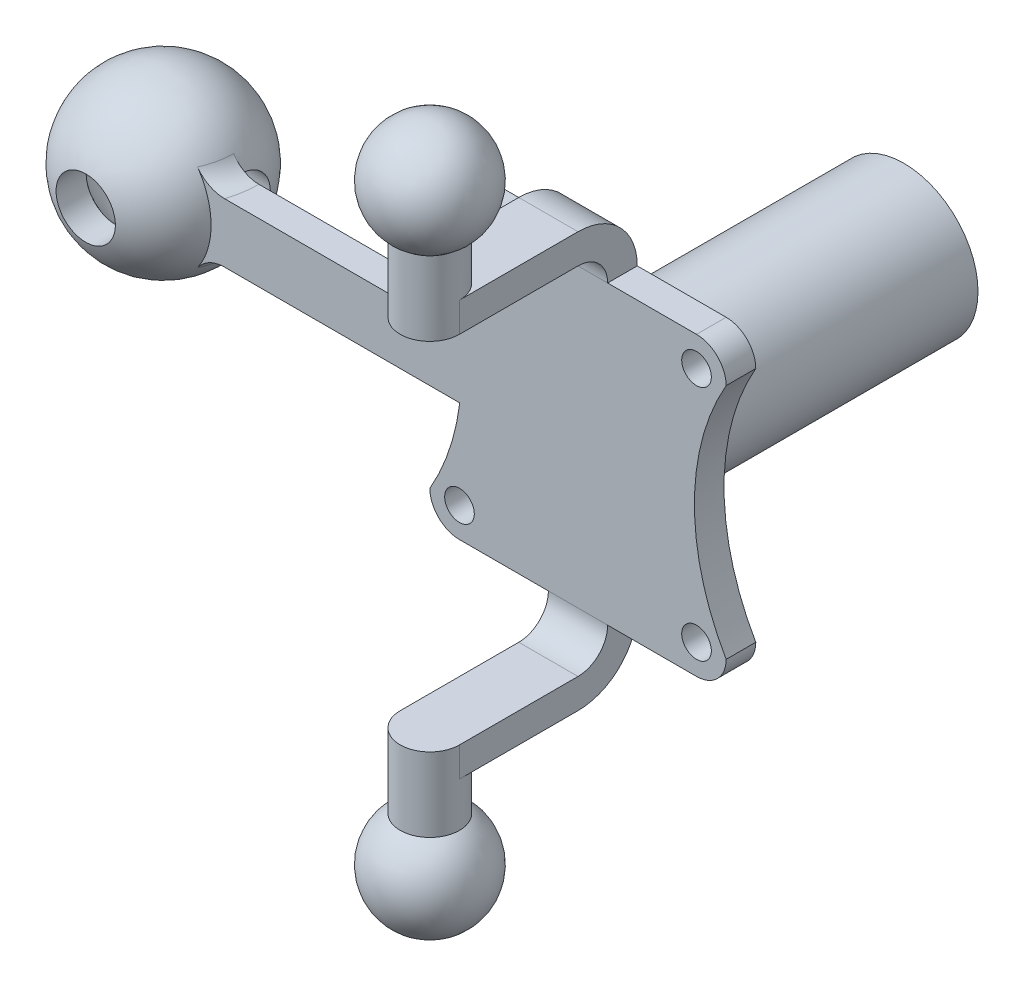
from build123d import *

# Parameters (mm, degrees)
BOSS_EXTRUDE1_DEPTH  = 10
CUT_EXTRUDE1_DEPTH   = 10
SKETCH6_W            = 20
SKETCH6_H            = 10
BOSS_EXTRUDE5_DEPTH  = 10
SKETCH7_W            = 20
SKETCH7_H            = 10
BOSS_EXTRUDE6_DEPTH  = 60
FILLET7_R            = 20
FILLET8_R            = 10
BOSS_EXTRUDE7_DEPTH  = 10
CUT_EXTRUDE7_DEPTH   = 18
FILLET7_OF_MIRROR2_R = 20
FILLET8_OF_MIRROR2_R = 10
SKETCH19_R           = 5
CUT_EXTRUDE9_DEPTH   = 30
SKETCH29_R           = 10
BOSS_EXTRUDE16_DEPTH = 15
SKETCH31_R           = 10
BOSS_EXTRUDE17_DEPTH = 15
BOSS_EXTRUDE21_DEPTH = 10
FILLET9_R            = 10
FILLET10_R           = 10
SKETCH35_R           = 10
CUT_EXTRUDE11_DEPTH  = 30
SKETCH16_R           = 25
BOSS_EXTRUDE22_DEPTH = 100


with BuildPart() as part:
    # Sketch2 → Boss-Extrude1 (new body)
    with BuildSketch(Plane.XY):
        with BuildLine():
            Line((-40, 50), (40, 50))
            ThreePointArc((40, 50), (47.071067812, 47.071067812), (50, 40))
            Line((50, 40), (50, -40))
            ThreePointArc((50, -40), (47.071067812, -47.071067812), (40, -50))
            Line((40, -50), (-40, -50))
            ThreePointArc((-40, -50), (-47.071067812, -47.071067812), (-50, -40))
            Line((-50, -40), (-50, 40))
            ThreePointArc((-50, 40), (-47.071067812, 47.071067812), (-40, 50))
        make_face()
    boss_extrude1 = extrude(amount=BOSS_EXTRUDE1_DEPTH)

    # Sketch3 → Cut-Extrude1 (cut)
    with BuildSketch(Plane.XY.offset(10)):
        with BuildLine():
            Line((-50, 40), (-50, -40))
            ThreePointArc((-50, -40), (-39.282032303, 0), (-50, 40))
        make_face()
        with BuildLine():
            Line((50, 40), (50, -40))
            ThreePointArc((50, -40), (39.282032303, 0), (50, 40))
        make_face()
    cut_extrude1 = extrude(amount=-CUT_EXTRUDE1_DEPTH, mode=Mode.SUBTRACT)

    # Sketch6 → Boss-Extrude5 (add)
    with BuildSketch(Plane.XZ.offset(50)):
        with Locations((0, 5)):
            Rectangle(SKETCH6_W, SKETCH6_H)
    boss_extrude5 = extrude(amount=BOSS_EXTRUDE5_DEPTH)

    # Sketch7 → Boss-Extrude6 (add)
    with BuildSketch(Plane.XY):
        with Locations((0, -65)):
            Rectangle(SKETCH7_W, SKETCH7_H)
    boss_extrude6 = extrude(amount=BOSS_EXTRUDE6_DEPTH)

    # Fillet7
    fillet7_edges = [part.edges().sort_by_distance(p)[0] for p in [
        (0, -70, 0),
    ]]
    fillet(fillet7_edges, radius=FILLET7_R)

    # Fillet8
    fillet8_edges = [part.edges().sort_by_distance(p)[0] for p in [
        (0, -60, 10),
    ]]
    fillet(fillet8_edges, radius=FILLET8_R)

    # Sketch8 → Boss-Extrude7 (add)
    with BuildSketch(Plane(origin=(0, -60, 0), x_dir=(1, 0, 0), z_dir=(0, 1, 0))):
        with BuildLine():
            Line((10, -60), (-10, -60))
            ThreePointArc((-10, -60), (0, -70), (10, -60))
        make_face()
    boss_extrude7 = extrude(amount=-BOSS_EXTRUDE7_DEPTH)

    # Sketch14 → Cut-Extrude7 (cut)
    with BuildSketch(Plane.XY.offset(10)):
        with BuildLine():
            Line((-39.282032303, 0), (39.282032303, 0))
            add(Edge.make_bspline(
                [(50, 40), (39.359472874, 21.350658255), (39.282032303, 0)],
                knots=[0, 0, 0, 1, 1, 1], degree=2))
            add(Edge.make_bspline(
                [(40, 50), (49.142135624, 49.142135624), (50, 40)],
                knots=[0, 0, 0, 1, 1, 1], degree=2))
            Line((40, 50), (-40, 50))
            add(Edge.make_bspline(
                [(-50, 40), (-49.142135624, 49.142135624), (-40, 50)],
                knots=[0, 0, 0, 1, 1, 1], degree=2))
            add(Edge.make_bspline(
                [(-39.282032303, 0), (-39.359472874, 21.350658255), (-50, 40)],
                knots=[0, 0, 0, 1, 1, 1], degree=2))
        make_face()
    extrude(amount=-CUT_EXTRUDE7_DEPTH, mode=Mode.SUBTRACT)


with BuildPart() as cut_extrude7_kept_piece:
    # of the separate pieces the step leaves, the one the design keeps (cut_extrude7_pieces_kept)
    add(part.part.solids().sort_by_distance((-10, -60, 20))[0])

    # Mirror2: Boss-Extrude1, Cut-Extrude1, Boss-Extrude5, Boss-Extrude6, Boss-Extrude7 across plane
    add(boss_extrude1.mirror(Plane(origin=(-39.282032303, 0, -8), x_dir=(0, 0, 1), z_dir=(0, -1, 0))))
    add(cut_extrude1.mirror(Plane(origin=(-39.282032303, 0, -8), x_dir=(0, 0, 1), z_dir=(0, -1, 0))), mode=Mode.SUBTRACT)
    add(boss_extrude5.mirror(Plane(origin=(-39.282032303, 0, -8), x_dir=(0, 0, 1), z_dir=(0, -1, 0))))
    add(boss_extrude6.mirror(Plane(origin=(-39.282032303, 0, -8), x_dir=(0, 0, 1), z_dir=(0, -1, 0))))
    add(boss_extrude7.mirror(Plane(origin=(-39.282032303, 0, -8), x_dir=(0, 0, 1), z_dir=(0, -1, 0))))

    # Fillet7 of Mirror2
    fillet7_of_mirror2_edges = [cut_extrude7_kept_piece.edges().sort_by_distance(p)[0] for p in [
        (0, 70, 0),
    ]]
    fillet(fillet7_of_mirror2_edges, radius=FILLET7_OF_MIRROR2_R)

    # Fillet8 of Mirror2
    fillet8_of_mirror2_edges = [cut_extrude7_kept_piece.edges().sort_by_distance(p)[0] for p in [
        (0, 60, 10),
    ]]
    fillet(fillet8_of_mirror2_edges, radius=FILLET8_OF_MIRROR2_R)

    # Sketch19 → Cut-Extrude9 (cut)
    with BuildSketch(Plane.XY.offset(10)):
        with Locations((-40, 40)):
            Circle(SKETCH19_R)
        with Locations((40, 40)):
            Circle(SKETCH19_R)
        with Locations((-40, -40)):
            Circle(SKETCH19_R)
        with Locations((40, -40)):
            Circle(SKETCH19_R)
    extrude(amount=-CUT_EXTRUDE9_DEPTH, mode=Mode.SUBTRACT)

    # Sketch29 → Boss-Extrude16 (add)
    with BuildSketch(Plane(origin=(0, 70, 0), x_dir=(1, 0, 0), z_dir=(0, 1, 0))):
        with Locations(Location((0, -60, 0), (0, 0, 180))):
            Circle(SKETCH29_R)
    extrude(amount=BOSS_EXTRUDE16_DEPTH)

    # Sketch30 → Revolve2 (revolve)
    with BuildSketch(Plane(origin=(0, 0, 0), x_dir=(0, 0, -1), z_dir=(1, 0, 0))):
        with BuildLine():
            Line((-60, 118.027756377), (-60, 85))
            Line((-60, 85), (-50, 85))
            ThreePointArc((-50, 85), (-42.745778116, 105.224158035), (-60, 118.027756377))
        make_face()
    revolve(axis=Axis((0, 85, 60), (0, 1, 0)))

    # Sketch31 → Boss-Extrude17 (add)
    with BuildSketch(Plane.XZ.offset(70)):
        with Locations(Location((0, 60, 0), (0, 0, 180))):
            Circle(SKETCH31_R)
    extrude(amount=BOSS_EXTRUDE17_DEPTH)

    # Sketch32 → Revolve3 (revolve)
    with BuildSketch(Plane(origin=(0, 0, 0), x_dir=(0, 0, -1), z_dir=(1, 0, 0))):
        with BuildLine():
            Line((-60, -118.027756377), (-60, -85))
            Line((-60, -85), (-70, -85))
            ThreePointArc((-70, -85), (-77.254221884, -105.224158035), (-60, -118.027756377))
        make_face()
    revolve(axis=Axis((0, -85, 60), (0, -1, 0)))

    # Sketch33 → Boss-Extrude21 (add)
    with BuildSketch(Plane.XY.offset(10)):
        with BuildLine():
            Line((-134, 10), (-39.909492971, 10))
            ThreePointArc((-39.909492971, 10), (-39.282032303, 0), (-39.909492971, -10))
            Line((-39.909492971, -10), (-134, -10))
            Line((-134, -10), (-134, 10))
        make_face()
    extrude(amount=-BOSS_EXTRUDE21_DEPTH)

    # Sketch34 → Revolve5 (revolve)
    with BuildSketch(Plane.XY):
        with BuildLine():
            Line((-178, 0), (-168.867962264, 0))
            ThreePointArc((-168.867962264, 0), (-155.201567253, 18.136805069), (-134, 10))
            Line((-134, 10), (-123.846606339, 10))
            ThreePointArc((-123.846606339, 10), (-155.08453427, 27.534478591), (-178, 0))
        make_face()
    revolve(axis=Axis((-134, 0, 0), (-1, 0, 0)))

    # Fillet9
    # the kernel refuses this fillet: 10 mm, written as the material it adds along each edge
    with BuildSketch(Plane(origin=(-150, 10, 0), x_dir=(1, 0, 0), z_dir=(0, 0, -1))) as fillet9_piece_1_section:
        with BuildLine():
            CenterArc((32.310988843, -10), FILLET9_R, 90, 58.243136141)
            ThreePointArc((23.808097042, -4.736842105), (25.09276901, -2.423886002), (26.153393661, 0))
            Line((26.153393661, 0), (32.310988843, 0))
        make_face()
    fillet9_piece_1 = revolve(axis=Axis((-150, 10, 0), (0, -1, 0)), revolution_arc=56.205276657, mode=Mode.PRIVATE)
    fillet9_piece_1 = split(fillet9_piece_1, bisect_by=Plane(origin=(-123.595029593, 11.027181376, 10), z_dir=(0, 0, -1)), keep=Keep.TOP, mode=Mode.PRIVATE)
    add(fillet9_piece_1)

    # Fillet10
    # the kernel refuses this fillet: 10 mm, written as the material it adds along each edge
    with BuildSketch(Plane(origin=(-150, -10, 0), x_dir=(0.5562190835944724, 0, 0.8310356978164808), z_dir=(-0.8310356978164808, 0, 0.5562190835944724))) as fillet10_piece_1_section:
        with BuildLine():
            CenterArc((32.310988843, -10), FILLET10_R, 90, 58.243136141)
            ThreePointArc((23.808097042, -4.736842105), (25.09276901, -2.423886002), (26.153393661, 0))
            Line((26.153393661, 0), (32.310988843, 0))
        make_face()
    fillet10_piece_1 = revolve(axis=Axis((-150, -10, 0), (0, 1, 0)), revolution_arc=56.205276657, mode=Mode.PRIVATE)
    fillet10_piece_1 = split(fillet10_piece_1, bisect_by=Plane(origin=(-123.595029593, -11.027181376, 10), z_dir=(0, 0, -1)), keep=Keep.TOP, mode=Mode.PRIVATE)
    add(fillet10_piece_1)

    # Sketch35 → Cut-Extrude11 (cut)
    with BuildSketch(Plane.XY):
        with Locations(Location((-150, 0, 0), (0, 0, 180))):
            Circle(SKETCH35_R)
    extrude(amount=CUT_EXTRUDE11_DEPTH, mode=Mode.SUBTRACT)

    # Sketch16 → Boss-Extrude22 (add)
    with BuildSketch(Plane(origin=(0, 0, 0), x_dir=(-1, 0, 0), z_dir=(0, 0, -1))):
        with Locations(Location((0, 0, 0), (0, 0, 180))):
            Circle(SKETCH16_R)
    extrude(amount=BOSS_EXTRUDE22_DEPTH)


solid = cut_extrude7_kept_piece.part
